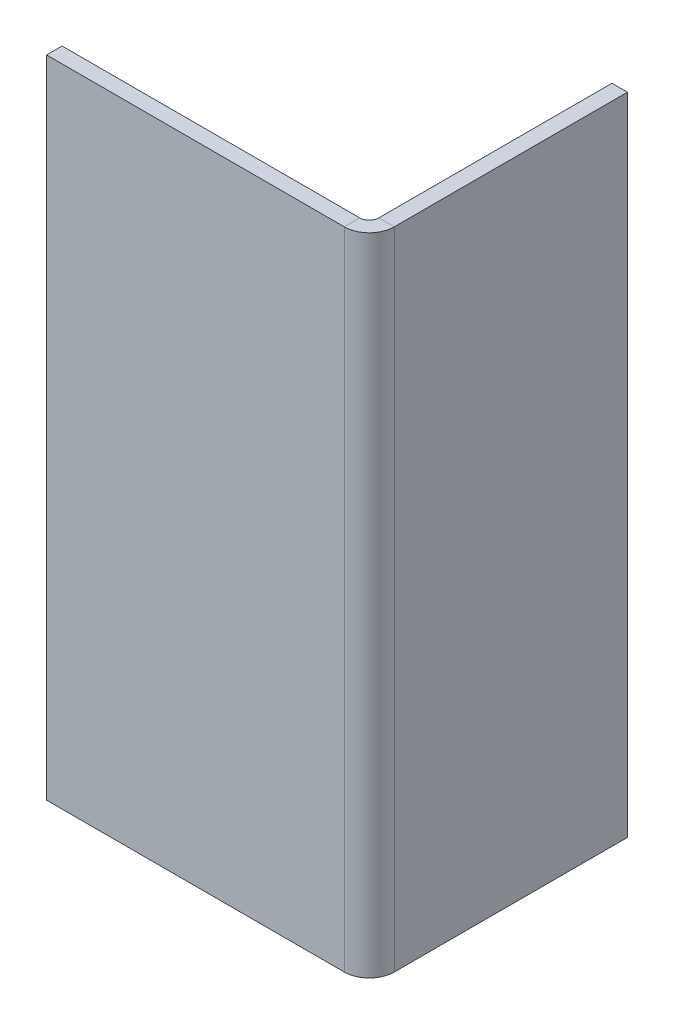
from build123d import *

# Parameters (mm, degrees)
SKETCH4_W                    = 25
SKETCH4_H                    = 50
BASE_FLANGE1_DEPTH           = 1.2
EDGE_FLANGE1_STRIP_W         = 6.2732
EDGE_FLANGE1_STRIP_H         = 1.2
EDGE_FLANGE1_STRIP_CUT_DEPTH = 50
EDGE_FLANGE1_DEPTH           = 50


# Sheet-metal steps are written as plain solids
with BuildPart() as part:
    # Sketch4 → Base-Flange1 (new body)
    with BuildSketch(Plane.XY):
        with Locations((12.5, 25)):
            Rectangle(SKETCH4_W, SKETCH4_H)
    extrude(amount=-BASE_FLANGE1_DEPTH)

    # Edge-Flange1 strip (across the edge) → Edge-Flange1 strip cut (cut)
    with BuildSketch(Plane(origin=(25, 50, -1.2), x_dir=(-1, 0, 0), z_dir=(0, -1, 0))):
        with Locations((-1.2, -0.6)):
            Rectangle(EDGE_FLANGE1_STRIP_W, EDGE_FLANGE1_STRIP_H)
    extrude(amount=EDGE_FLANGE1_STRIP_CUT_DEPTH, mode=Mode.SUBTRACT)

    # Edge-Flange1 section (across the edge) → Edge-Flange1 (add)
    with BuildSketch(Plane(origin=(25, 50, -1.2), x_dir=(-1, 0, 0), z_dir=(0, -1, 0))):
        with BuildLine():
            Line((0, 0.7366), (0, 18.8))
            Line((0, 18.8), (1.2, 18.8))
            Line((1.2, 18.8), (1.2, 0.7366))
            ThreePointArc((1.2, 0.7366), (1.415745145, 0.215745145), (1.9366, 0))
            Line((1.9366, 0), (1.9366, -1.2))
            ThreePointArc((1.9366, -1.2), (0.567217008, -0.632782992), (0, 0.7366))
        make_face()
    extrude(amount=EDGE_FLANGE1_DEPTH)


solid = part.part
